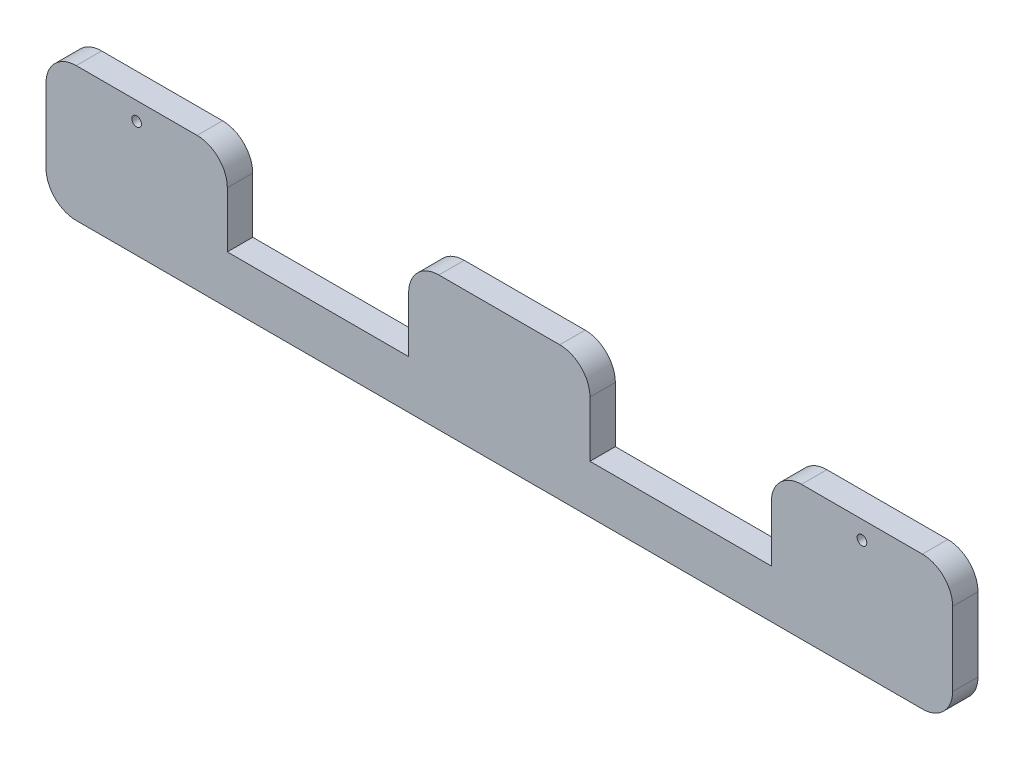
from build123d import *

# Parameters (mm, degrees)
SKETCH1_W           = 190.5
SKETCH1_H           = 28.194
BOSS_EXTRUDE1_DEPTH = 5.334
SKETCH3_W           = 38.1
SKETCH3_H           = 18.034
CUT_EXTRUDE1_DEPTH  = 122.162721385
SKETCH4_R           = 1.016
CUT_EXTRUDE2_DEPTH  = 122.162721385
FILLET1_R           = 6.35


with BuildPart() as part:
    # Sketch1 → Boss-Extrude1 (new body)
    with BuildSketch(Plane.XY):
        with Locations((10.187554582, -45.357819662)):
            Rectangle(SKETCH1_W, SKETCH1_H)
    extrude(amount=BOSS_EXTRUDE1_DEPTH)

    # Sketch3 → Cut-Extrude1 (cut, through all)
    with BuildSketch(Plane.XY.offset(5.334)):
        with Locations((-27.912445418, -40.277819662)):
            Rectangle(SKETCH3_W, SKETCH3_H)
        with Locations((48.287554582, -40.277819662)):
            Rectangle(SKETCH3_W, SKETCH3_H)
    extrude(amount=-CUT_EXTRUDE1_DEPTH, mode=Mode.SUBTRACT)

    # Sketch4 → Cut-Extrude2 (cut, through all)
    with BuildSketch(Plane.XY.offset(5.334)):
        with Locations((-66.012445418, -35.070819662)):
            Circle(SKETCH4_R)
        with Locations((86.387554582, -35.070819662)):
            Circle(SKETCH4_R)
    extrude(amount=-CUT_EXTRUDE2_DEPTH, mode=Mode.SUBTRACT)

    # Fillet1
    fillet1_edges = [part.edges().sort_by_distance(p)[0] for p in [
        (29.237554582, -31.260819662, 2.667),
        (-8.862445418, -31.260819662, 2.667),
        (-46.962445418, -31.260819662, 2.667),
        (67.337554582, -31.260819662, 2.667),
        (105.437554582, -31.260819662, 2.667),
        (105.437554582, -59.454819662, 2.667),
        (-85.062445418, -59.454819662, 2.667),
        (-85.062445418, -31.260819662, 2.667),
    ]]
    fillet(fillet1_edges, radius=FILLET1_R)


solid = part.part
